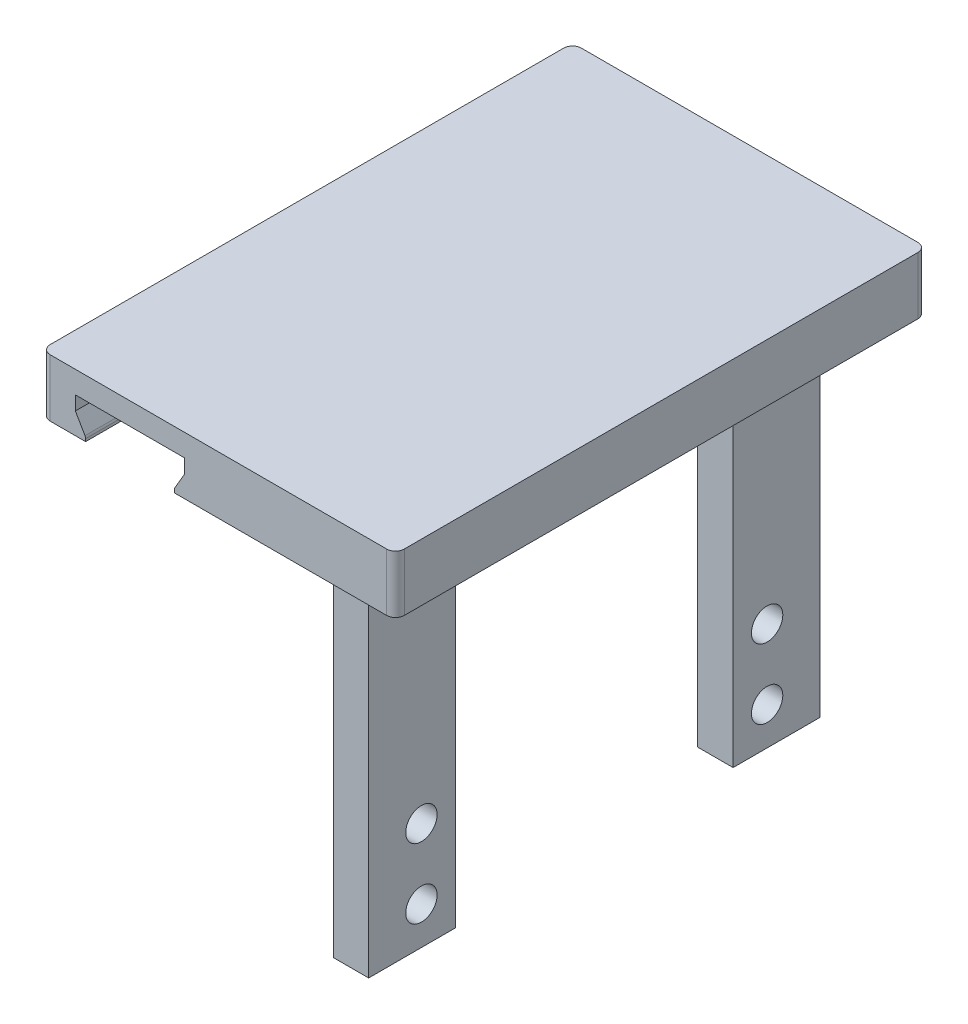
from build123d import *

# Parameters (mm, degrees)
SKETCH2_W           = 50.8
SKETCH2_H           = 76.2
BOSS_EXTRUDE1_DEPTH = 3.175
SKETCH2_5_W         = 6.35
SKETCH2_5_H         = 76.2
SKETCH2_5_W_2       = 5.08
SKETCH2_5_H_2       = 12.446
BOSS_EXTRUDE2_DEPTH = 5.08
SKETCH2_6_W         = 5.08
SKETCH2_6_H         = 12.446
BOSS_EXTRUDE3_DEPTH = 57.15
SKETCH4_R           = 2.249999945
CUT_EXTRUDE1_DEPTH  = 50.8
FILLET1_R           = 1.27
CUT_EXTRUDE2_DEPTH  = 101.6
FILLET2_R           = 0.635


with BuildPart() as part:
    # Sketch2 → Boss-Extrude1 (new body)
    with BuildSketch(Plane(origin=(0, 0, 0), x_dir=(1, 0, 0), z_dir=(0, 1, 0))):
        with Locations((25.4, -38.1)):
            Rectangle(SKETCH2_W, SKETCH2_H)
    extrude(amount=BOSS_EXTRUDE1_DEPTH)

    # Sketch2<5> → Boss-Extrude2 (add)
    # profile 1 of 2: a face of its own
    with BuildSketch(Plane(origin=(0, 0, 0), x_dir=(1, 0, 0), z_dir=(0, 1, 0))):
        with Locations((3.175, -38.1)):
            Rectangle(SKETCH2_5_W, SKETCH2_5_H)
    # profile 2 of 2: a face of its own
    with BuildSketch(Plane(origin=(0, 0, 0), x_dir=(1, 0, 0), z_dir=(0, 1, 0))):
        Polygon((50.8, 0), (19.0754, 0), (19.0754, -38.1), (19.0754, -76.2), (50.8, -76.2), align=None)
        with Locations((38.678980046, -64.240991406)):
            Rectangle(SKETCH2_5_W_2, SKETCH2_5_H_2, mode=Mode.SUBTRACT)
        with Locations((38.678980046, -11.959008594)):
            Rectangle(SKETCH2_5_W_2, SKETCH2_5_H_2, mode=Mode.SUBTRACT)
    extrude(amount=-BOSS_EXTRUDE2_DEPTH)

    # Sketch2<6> → Boss-Extrude3 (add)
    with BuildSketch(Plane(origin=(0, 0, 0), x_dir=(1, 0, 0), z_dir=(0, 1, 0))):
        with Locations((38.678980046, -11.959008594)):
            Rectangle(SKETCH2_6_W, SKETCH2_6_H)
        with Locations((38.678980046, -64.240991406)):
            Rectangle(SKETCH2_6_W, SKETCH2_6_H)
    extrude(amount=-BOSS_EXTRUDE3_DEPTH)

    # Sketch4 → Cut-Extrude1 (cut)
    with BuildSketch(Plane.ZY.offset(-36.138980046)):
        with Locations((13.305208594, -41.743296244)):
            Circle(SKETCH4_R)
        with Locations((13.305208594, -51.743296056)):
            Circle(SKETCH4_R)
        with Locations((62.894791406, -41.743296244)):
            Circle(SKETCH4_R)
        with Locations((62.894791406, -51.743296056)):
            Circle(SKETCH4_R)
    extrude(amount=-CUT_EXTRUDE1_DEPTH, mode=Mode.SUBTRACT)

    # Fillet1
    fillet1_edges = [part.edges().sort_by_distance(p)[0] for p in [
        (0, -0.9525, 0),
        (0, -0.9525, 76.2),
        (50.8, -0.9525, 76.2),
        (50.8, -0.9525, 0),
        (38.678980046, -5.08, 70.463991406),
        (36.138980046, -5.08, 64.240991406),
        (38.678980046, -5.08, 58.017991406),
        (41.218980046, -5.08, 11.959008594),
        (36.138980046, -5.08, 11.959008594),
        (38.678980046, -5.08, 5.736008594),
        (41.218980046, -5.08, 64.240991406),
        (38.678980046, -5.08, 18.182008594),
    ]]
    fillet(fillet1_edges, radius=FILLET1_R)

    # Sketch5 → Cut-Extrude2 (cut)
    with BuildSketch(Plane(origin=(0, 0, 0), x_dir=(-1, 0, 0), z_dir=(0, 0, -1))):
        Polygon((-19.0754, 0), (-20.5486, 0), (-20.5486, -2.0066), (-19.0754, -4.532028908), align=None)
        Polygon((-4.8768, 0), (-6.35, 0), (-6.35, -4.532028908), (-4.8768, -2.0066), align=None)
    extrude(amount=-CUT_EXTRUDE2_DEPTH, mode=Mode.SUBTRACT)

    # Fillet2
    fillet2_edges = [part.edges().sort_by_distance(p)[0] for p in [
        (19.0754, -4.532028908, 38.1),
        (6.35, -4.532028908, 38.1),
    ]]
    fillet(fillet2_edges, radius=FILLET2_R)


solid = part.part
